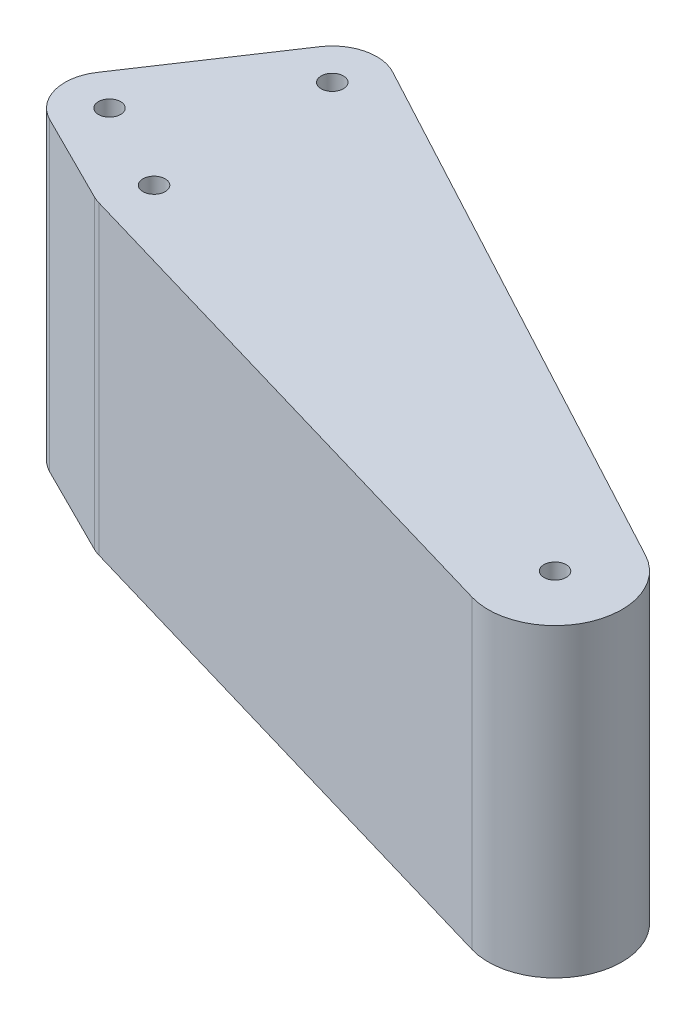
from build123d import *

# Parameters (mm, degrees)
BOSS_EXTRUDE1_DEPTH = 17
SKETCH2_R           = 2.5
CUT_EXTRUDE1_DEPTH  = 145.962064003
BOSS_EXTRUDE2_DEPTH = 51.5
SKETCH4_R           = 2.5
CUT_EXTRUDE2_DEPTH  = 160.427883383


with BuildPart() as part:
    # Sketch1 → Boss-Extrude1 (new body)
    with BuildSketch(Plane(origin=(0, 0, 0), x_dir=(1, 0, 0), z_dir=(0, 1, 0))):
        with BuildLine():
            Line((4.724564955, 48.813539923), (127.086847433, -16.779690115))
            ThreePointArc((127.086847433, -16.779690115), (133.880787219, -35.685397627), (115.776703796, -44.393184817))
            Line((115.776703796, -44.393184817), (-2.815530803, -9.595456545))
            ThreePointArc((-2.815530803, -9.595456545), (-3.658351002, -9.306796868), (-4.472135955, -8.94427191))
            Line((-4.472135955, -8.94427191), (-24.472135955, 1.05572809))
            ThreePointArc((-24.472135955, 1.05572809), (-29.664996488, 7.433320648), (-28.320502943, 15.547001962))
            Line((-28.320502943, 15.547001962), (-8.320502943, 45.547001962))
            ThreePointArc((-8.320502943, 45.547001962), (-2.429045094, 49.700502045), (4.724564955, 48.813539923))
        make_face()
    extrude(amount=BOSS_EXTRUDE1_DEPTH)

    # Sketch2 → Cut-Extrude1 (cut, through all)
    with BuildSketch(Plane(origin=(0, 17, 0), x_dir=(1, 0, 0), z_dir=(0, 1, 0))):
        with Locations((0, 40)):
            Circle(SKETCH2_R)
        Circle(SKETCH2_R)
        with Locations((120, -30)):
            Circle(SKETCH2_R)
        with Locations((-20, 10)):
            Circle(SKETCH2_R)
    extrude(amount=-CUT_EXTRUDE1_DEPTH, mode=Mode.SUBTRACT)

    # Sketch3 → Boss-Extrude2 (add)
    with BuildSketch(Plane(origin=(0, 17, 0), x_dir=(1, 0, 0), z_dir=(0, 1, 0))):
        with BuildLine():
            Line((-2.815530803, -9.595456545), (115.776703796, -44.393184817))
            ThreePointArc((115.776703796, -44.393184817), (133.880787219, -35.685397627), (127.086847433, -16.779690115))
            Line((127.086847433, -16.779690115), (4.724564955, 48.813539923))
            ThreePointArc((4.724564955, 48.813539923), (-2.429045094, 49.700502045), (-8.320502943, 45.547001962))
            Line((-8.320502943, 45.547001962), (-28.320502943, 15.547001962))
            ThreePointArc((-28.320502943, 15.547001962), (-29.664996488, 7.433320648), (-24.472135955, 1.05572809))
            Line((-24.472135955, 1.05572809), (-4.472135955, -8.94427191))
            ThreePointArc((-4.472135955, -8.94427191), (-3.658351002, -9.306796868), (-2.815530803, -9.595456545))
        make_face()
    extrude(amount=BOSS_EXTRUDE2_DEPTH)

    # Sketch4 → Cut-Extrude2 (cut, through all)
    with BuildSketch(Plane.XZ):
        with Locations((120, 30)):
            Circle(SKETCH4_R)
        with Locations((0, -40)):
            Circle(SKETCH4_R)
        with Locations((-20, -10)):
            Circle(SKETCH4_R)
        Circle(SKETCH4_R)
    extrude(amount=-CUT_EXTRUDE2_DEPTH, mode=Mode.SUBTRACT)


solid = part.part
